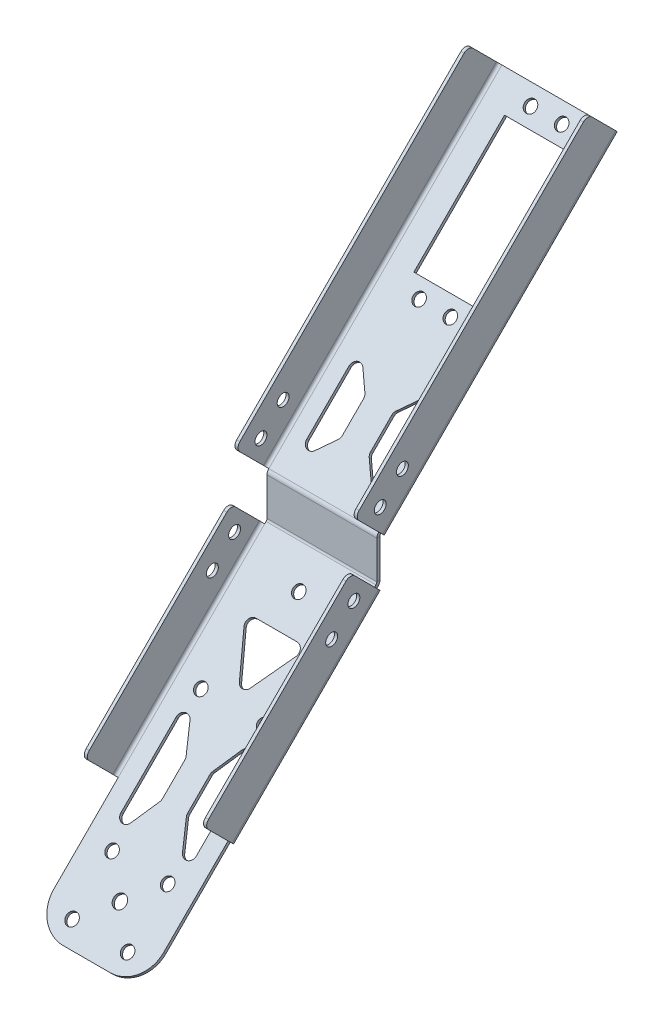
from build123d import *

# Parameters (mm, degrees)
BASE_FLANGE1_DEPTH     = 1
SKETCHED_START         = -32.5
SKETCHED_BEND5_DEPTH   = 65
SKETCHED_BEND5_2_DEPTH = 15
SKETCHED_START_2       = 17.5
SKETCHED_BEND5_3_DEPTH = 15
SKETCHED_BEND5_4_DEPTH = 65
SKETCHED_START_3       = -17.5
SKETCHED_BEND5_5_DEPTH = 35
SKETCHED_BEND6_DEPTH   = 65
SKETCHED_BEND6_2_DEPTH = 15
SKETCHED_BEND6_3_DEPTH = 15
SKETCHED_BEND6_4_DEPTH = 65
SKETCHED_BEND6_5_DEPTH = 35
SKETCHED_START_4       = -71.356310605
SKETCHED_BEND7_DEPTH   = 66
SKETCHED_BEND7_2_DEPTH = 66
SKETCHED_START_5       = 5.890889039
SKETCHED_BEND8_DEPTH   = 105
SKETCHED_BEND8_2_DEPTH = 105
F_6_CLEARANCE_HOLE2_D  = 3.7973
CUT_EXTRUDE1_REACH     = 121.977
SKETCH16_W             = 19.9
SKETCH16_H             = 40.84
CUT_EXTRUDE2_REACH     = 127.221
SKETCH31_R             = 2.025
F_6_CLEARANCE_HOLE4_D  = 3.7973
F_6_CLEARANCE_HOLE5_D  = 3.7973
FILLET1_R              = 10
FILLET2_R              = 2


# Read off the part's stored shape, not the designer's step: Sketched Bend5, Sketched Bend6, Sketched Bend7, Sketched Bend8
# Sheet-metal steps are written as plain solids
with BuildPart() as part:
    # Sketch1 → Base-Flange1 (new body)
    with BuildSketch(Plane.XY):
        Polygon((-32.5, -73.5), (-17.5, -73.5), (-17.5, -112.5), (17.5, -112.5), (17.5, -73.5), (32.5, -73.5), (32.5, -7.5), (17.5, -7.5), (17.5, 7.5), (32.5, 7.5), (32.5, 112.5), (17.5, 112.5), (-17.5, 112.5), (-32.5, 112.5), (-32.5, 7.5), (-17.5, 7.5), (-17.5, -7.5), (-32.5, -7.5), align=None)
    extrude(amount=-BASE_FLANGE1_DEPTH)

    # Sketched Bend5 outline → Sketched Bend5 (cut)
    with BuildSketch(Plane.YZ.offset(SKETCHED_START)):
        with BuildLine():
            Line((7.714213562, -0.585786438), (8.128427124, -1))
            Line((8.128427124, -1), (112.5, -1))
            Line((112.5, -1), (112.5, 0))
            Line((112.5, 0), (6.3, 0))
            ThreePointArc((6.3, 0), (7.065366865, -0.152240935), (7.714213562, -0.585786438))
        make_face()
    extrude(amount=SKETCHED_BEND5_DEPTH, mode=Mode.SUBTRACT)

    # Sketched Bend5 2 outline → Sketched Bend5 2 (cut)
    with BuildSketch(Plane.YZ.offset(SKETCHED_START)):
        with BuildLine():
            Line((7.729701149, -0.601274024), (7.714213562, -0.585786438))
            ThreePointArc((7.714213562, -0.585786438), (7.610403483, -0.48909209), (7.5, -0.4))
            Line((7.5, -0.4), (7.5, -0.830975173))
            Line((7.5, -0.830975173), (7.729701149, -0.601274024))
        make_face()
    extrude(amount=SKETCHED_BEND5_2_DEPTH, mode=Mode.SUBTRACT)

    # Sketched Bend5 3 outline → Sketched Bend5 3 (cut)
    with BuildSketch(Plane.YZ.offset(SKETCHED_START_2)):
        with BuildLine():
            Line((7.729701149, -0.601274024), (7.714213562, -0.585786438))
            ThreePointArc((7.714213562, -0.585786438), (7.610403483, -0.48909209), (7.5, -0.4))
            Line((7.5, -0.4), (7.5, -0.830975173))
            Line((7.5, -0.830975173), (7.729701149, -0.601274024))
        make_face()
    extrude(amount=SKETCHED_BEND5_3_DEPTH, mode=Mode.SUBTRACT)

    # Sketched Bend5 4 outline → Sketched Bend5 4 (add)
    with BuildSketch(Plane.YZ.offset(SKETCHED_START)):
        Polygon((81.975913173, -74.847486049), (8.128427124, -1), (7.5, -1), (7.5, -0.830975173), (7.022594368, -1.308380805), (81.268806392, -75.55459283), align=None)
    extrude(amount=SKETCHED_BEND5_4_DEPTH)

    # Sketched Bend5 5 outline → Sketched Bend5 5 (add)
    with BuildSketch(Plane.YZ.offset(SKETCHED_START_3)):
        with BuildLine():
            Line((7.022594368, -1.308380805), (7.330975173, -1))
            Line((7.330975173, -1), (6.3, -1))
            ThreePointArc((6.3, -1), (6.682683432, -1.076120467), (7.007106781, -1.292893219))
            Line((7.007106781, -1.292893219), (7.022594368, -1.308380805))
        make_face()
    extrude(amount=SKETCHED_BEND5_5_DEPTH)

    # Sketched Bend6 outline → Sketched Bend6 (cut)
    with BuildSketch(Plane.YZ.offset(SKETCHED_START)):
        with BuildLine():
            ThreePointArc((-5.710951377, -1), (-6.476318242, -0.847759065), (-7.12516494, -0.414213562))
            Line((-7.12516494, -0.414213562), (-7.539378502, 0))
            Line((-7.539378502, 0), (-112.5, 0))
            Line((-112.5, 0), (-112.5, -1))
            Line((-112.5, -1), (-5.710951377, -1))
        make_face()
    extrude(amount=SKETCHED_BEND6_DEPTH, mode=Mode.SUBTRACT)

    # Sketched Bend6 2 outline → Sketched Bend6 2 (cut)
    with BuildSketch(Plane.YZ.offset(SKETCHED_START)):
        Polygon((-7.539378502, 0), (-7.5, -0.039378502), (-7.5, 0), align=None)
    extrude(amount=SKETCHED_BEND6_2_DEPTH, mode=Mode.SUBTRACT)

    # Sketched Bend6 3 outline → Sketched Bend6 3 (cut)
    with BuildSketch(Plane.YZ.offset(SKETCHED_START_2)):
        Polygon((-7.539378502, 0), (-7.5, -0.039378502), (-7.5, 0), align=None)
    extrude(amount=SKETCHED_BEND6_3_DEPTH, mode=Mode.SUBTRACT)



with BuildPart() as body_2:
    # Sketched Bend6 4 outline → Sketched Bend6 4 (new body)
    with BuildSketch(Plane.YZ.offset(SKETCHED_START)):
        Polygon((-54.22622036, 46.686841858), (-7.557172802, 0.0177943), (-6.850066021, 0.724901081), (-53.519113579, 47.393948639), align=None)
    extrude(amount=SKETCHED_BEND6_4_DEPTH)


with BuildPart() as part_1:
    add(part.part)

    add(body_2.part)  # Sketched Bend6 5 merges body 2
    # Sketched Bend6 5 outline → Sketched Bend6 5 (add)
    with BuildSketch(Plane.YZ.offset(SKETCHED_START_3)):
        with BuildLine():
            Line((-7.557172802, 0.0177943), (-7.539378502, 0))
            Line((-7.539378502, 0), (-5.710951377, 0))
            ThreePointArc((-5.710951377, 0), (-6.09363481, 0.076120467), (-6.418058159, 0.292893219))
            Line((-6.418058159, 0.292893219), (-6.850066021, 0.724901081))
            Line((-6.850066021, 0.724901081), (-7.557172802, 0.0177943))
        make_face()
        Polygon((-81.803384826, 74.264006324), (-54.22622036, 46.686841858), (-53.519113579, 47.393948639), (-81.096278045, 74.971113105), align=None)
    extrude(amount=SKETCHED_BEND6_5_DEPTH)

    # Sketched Bend7 outline → Sketched Bend7 (cut)
    with BuildSketch(Plane(origin=(0, 0, 0), x_dir=(1, 0, 0), z_dir=(0, 0.707106781186546, -0.707106781186549)).offset(SKETCHED_START_4)):
        with BuildLine():
            ThreePointArc((-19.232050807, 4.331145665), (-18.5, 5.063196472), (-17.5, 5.331145665))
            Line((-17.5, 5.331145665), (-32.5, 5.331145665))
            Line((-32.5, 5.331145665), (-32.5, 4.331145665))
            Line((-32.5, 4.331145665), (-19.232050807, 4.331145665))
        make_face()
        with BuildLine():
            Line((32.5, 5.331145665), (17.5, 5.331145665))
            ThreePointArc((17.5, 5.331145665), (18.5, 5.063196472), (19.232050807, 4.331145665))
            Line((19.232050807, 4.331145665), (32.5, 4.331145665))
            Line((32.5, 4.331145665), (32.5, 5.331145665))
        make_face()
    extrude(amount=SKETCHED_BEND7_DEPTH, mode=Mode.SUBTRACT)

    # Sketched Bend7 2 outline → Sketched Bend7 2 (add)
    with BuildSketch(Plane(origin=(0, 0, 0), x_dir=(1, 0, 0), z_dir=(0, 0.707106781186546, -0.707106781186549)).offset(SKETCHED_START_4)):
        with BuildLine():
            Line((-17.5, 4.331145665), (-19.232050807, 4.331145665))
            ThreePointArc((-19.232050807, 4.331145665), (-19.431851652, 3.848783755), (-19.5, 3.331145665))
            Line((-19.5, 3.331145665), (-19.5, -9.312659845))
            Line((-19.5, -9.312659845), (-18.5, -9.312659845))
            Line((-18.5, -9.312659845), (-18.5, 3.331145665))
            ThreePointArc((-18.5, 3.331145665), (-18.207106781, 4.038252446), (-17.5, 4.331145665))
        make_face()
        with BuildLine():
            ThreePointArc((19.5, 3.331145665), (19.431851652, 3.848783755), (19.232050807, 4.331145665))
            Line((19.232050807, 4.331145665), (17.5, 4.331145665))
            ThreePointArc((17.5, 4.331145665), (18.207106781, 4.038252446), (18.5, 3.331145665))
            Line((18.5, 3.331145665), (18.5, -9.312659845))
            Line((18.5, -9.312659845), (19.5, -9.312659845))
            Line((19.5, -9.312659845), (19.5, 3.331145665))
        make_face()
    extrude(amount=SKETCHED_BEND7_2_DEPTH)

    # Sketched Bend8 outline → Sketched Bend8 (cut)
    with BuildSketch(Plane(origin=(0, 0, 0), x_dir=(1, 0, 0), z_dir=(0, 0.707106781186546, -0.707106781186549)).offset(SKETCHED_START_5)):
        with BuildLine():
            Line((-32.5, -5.040559159), (-19.232050807, -5.040559159))
            ThreePointArc((-19.232050807, -5.040559159), (-18.5, -4.308508352), (-17.5, -4.040559159))
            Line((-17.5, -4.040559159), (-32.5, -4.040559159))
            Line((-32.5, -4.040559159), (-32.5, -5.040559159))
        make_face()
        with BuildLine():
            Line((32.5, -4.040559159), (17.5, -4.040559159))
            ThreePointArc((17.5, -4.040559159), (18.5, -4.308508352), (19.232050807, -5.040559159))
            Line((19.232050807, -5.040559159), (32.5, -5.040559159))
            Line((32.5, -5.040559159), (32.5, -4.040559159))
        make_face()
    extrude(amount=SKETCHED_BEND8_DEPTH, mode=Mode.SUBTRACT)

    # Sketched Bend8 2 outline → Sketched Bend8 2 (add)
    with BuildSketch(Plane(origin=(0, 0, 0), x_dir=(1, 0, 0), z_dir=(0, 0.707106781186546, -0.707106781186549)).offset(SKETCHED_START_5)):
        with BuildLine():
            ThreePointArc((-19.232050807, -5.040559159), (-19.431851652, -5.522921069), (-19.5, -6.040559159))
            Line((-19.5, -6.040559159), (-19.5, -18.684364669))
            Line((-19.5, -18.684364669), (-18.5, -18.684364669))
            Line((-18.5, -18.684364669), (-18.5, -6.040559159))
            ThreePointArc((-18.5, -6.040559159), (-18.207106781, -5.333452378), (-17.5, -5.040559159))
            Line((-17.5, -5.040559159), (-19.232050807, -5.040559159))
        make_face()
        with BuildLine():
            Line((19.232050807, -5.040559159), (17.5, -5.040559159))
            ThreePointArc((17.5, -5.040559159), (18.207106781, -5.333452378), (18.5, -6.040559159))
            Line((18.5, -6.040559159), (18.5, -18.684364669))
            Line((18.5, -18.684364669), (19.5, -18.684364669))
            Line((19.5, -18.684364669), (19.5, -6.040559159))
            ThreePointArc((19.5, -6.040559159), (19.431851652, -5.522921069), (19.232050807, -5.040559159))
        make_face()
    extrude(amount=SKETCHED_BEND8_2_DEPTH)

    # #6 Clearance Hole2 (through all)
    with Locations(Plane(origin=(19.5, 0, 0), x_dir=(0, 0, -1), z_dir=(1, 0, 0))):
        with Locations((-9.311868306, -5.334166607), (-16.382936118, -12.405234419), (-0.914625389, 16.316668374), (6.156442422, 23.387736186)):
            Hole(F_6_CLEARANCE_HOLE2_D / 2)

    # Sketch16 → Cut-Extrude1 (cut, up to next)
    with BuildSketch(Plane(origin=(0, 3.564213562, 3.564213562), x_dir=(1, 0, 0), z_dir=(0, 0.7071067811865487, 0.7071067811865465)), mode=Mode.PRIVATE) as cut_extrude1_sk1:
        with BuildLine():
            Line((-12.5, 34.910953453), (-12.5, 15.870824627))
            ThreePointArc((-12.5, 15.870824627), (-11.185694979, 13.992042469), (-8.970177604, 14.582553136))
            Line((-8.970177604, 14.582553136), (-4.970177604, 19.332553136))
            ThreePointArc((-4.970177604, 19.332553136), (-4.621217842, 19.935129648), (-4.5, 20.620824627))
            Line((-4.5, 20.620824627), (-4.5, 30.160953453))
            ThreePointArc((-4.5, 30.160953453), (-4.621217842, 30.846648432), (-4.970177604, 31.449224944))
            Line((-4.970177604, 31.449224944), (-8.970177604, 36.199224944))
            ThreePointArc((-8.970177604, 36.199224944), (-11.185694979, 36.789735611), (-12.5, 34.910953453))
        make_face()
    cut_extrude1_tool1 = extrude(cut_extrude1_sk1.sketch, amount=-CUT_EXTRUDE1_REACH, mode=Mode.PRIVATE) & part_1.part
    # Sketch16 → Cut-Extrude1 (cut, up to next)
    with BuildSketch(Plane(origin=(0, 3.564213562, 3.564213562), x_dir=(1, 0, 0), z_dir=(0, 0.7071067811865487, 0.7071067811865465)), mode=Mode.PRIVATE) as cut_extrude1_sk2:
        with BuildLine():
            Line((4.5, 20.620824627), (4.5, 30.160953453))
            ThreePointArc((4.5, 30.160953453), (4.621217842, 30.846648432), (4.970177604, 31.449224944))
            Line((4.970177604, 31.449224944), (8.970177604, 36.199224944))
            ThreePointArc((8.970177604, 36.199224944), (11.185694979, 36.789735611), (12.5, 34.910953453))
            Line((12.5, 34.910953453), (12.5, 15.870824627))
            ThreePointArc((12.5, 15.870824627), (11.185694979, 13.992042469), (8.970177604, 14.582553136))
            Line((8.970177604, 14.582553136), (4.970177604, 19.332553136))
            ThreePointArc((4.970177604, 19.332553136), (4.621217842, 19.935129648), (4.5, 20.620824627))
        make_face()
    cut_extrude1_tool2 = extrude(cut_extrude1_sk2.sketch, amount=-CUT_EXTRUDE1_REACH, mode=Mode.PRIVATE) & part_1.part
    # Sketch16 → Cut-Extrude1 (cut, up to next)
    with BuildSketch(Plane(origin=(0, 3.564213562, 3.564213562), x_dir=(1, 0, 0), z_dir=(0, 0.7071067811865487, 0.7071067811865465)), mode=Mode.PRIVATE) as cut_extrude1_sk3:
        with Locations((0, 80.970889039)):
            Rectangle(SKETCH16_W, SKETCH16_H)
    cut_extrude1_tool3 = extrude(cut_extrude1_sk3.sketch, amount=-CUT_EXTRUDE1_REACH, mode=Mode.PRIVATE) & part_1.part
    add(cut_extrude1_tool1.solids().sort_by_distance((-8.925772, 21.518283, -14.389856))[0], mode=Mode.SUBTRACT)
    add(cut_extrude1_tool2.solids().sort_by_distance((8.925772, 21.518283, -14.389856))[0], mode=Mode.SUBTRACT)
    add(cut_extrude1_tool3.solids().sort_by_distance((0, 60.819278, -53.690851))[0], mode=Mode.SUBTRACT)

    # Sketch31 → Cut-Extrude2 (cut, up to next)
    with BuildSketch(Plane(origin=(0, -3.769689251, -3.769689251), x_dir=(-1, 0, 0), z_dir=(0, -0.7071067811865487, -0.7071067811865465)), mode=Mode.PRIVATE) as cut_extrude2_sk1:
        with Locations(Location((0, -95.356310605, 0), (0, 0, 90))):
            Circle(SKETCH31_R)
    cut_extrude2_tool1 = extrude(cut_extrude2_sk1.sketch, amount=-CUT_EXTRUDE2_REACH, mode=Mode.PRIVATE) & part_1.part
    # Sketch31 → Cut-Extrude2 (cut, up to next)
    with BuildSketch(Plane(origin=(0, -3.769689251, -3.769689251), x_dir=(-1, 0, 0), z_dir=(0, -0.7071067811865487, -0.7071067811865465)), mode=Mode.PRIVATE) as cut_extrude2_sk2:
        with BuildLine():
            Line((1.732050808, -39.065867303), (8.267949192, -27.745359227))
            ThreePointArc((8.267949192, -27.745359227), (8.267949192, -25.745359227), (6.535898385, -24.745359227))
            Line((6.535898385, -24.745359227), (-6.535898385, -24.745359227))
            ThreePointArc((-6.535898385, -24.745359227), (-8.267949192, -25.745359227), (-8.267949192, -27.745359227))
            Line((-8.267949192, -27.745359227), (-1.732050808, -39.065867303))
            ThreePointArc((-1.732050808, -39.065867303), (0, -40.065867303), (1.732050808, -39.065867303))
        make_face()
    cut_extrude2_tool2 = extrude(cut_extrude2_sk2.sketch, amount=-CUT_EXTRUDE2_REACH, mode=Mode.PRIVATE) & part_1.part
    # Sketch31 → Cut-Extrude2 (cut, up to next)
    with BuildSketch(Plane(origin=(0, -3.769689251, -3.769689251), x_dir=(-1, 0, 0), z_dir=(0, -0.7071067811865487, -0.7071067811865465)), mode=Mode.PRIVATE) as cut_extrude2_sk3:
        with BuildLine():
            Line((-12, -53.065867303), (-12, -77.856310605))
            ThreePointArc((-12, -77.856310605), (-10.490758652, -79.795164891), (-8.240844055, -78.807820122))
            Line((-8.240844055, -78.807820122), (-4.240844055, -71.412598471))
            ThreePointArc((-4.240844055, -71.412598471), (-4.061145713, -70.951847606), (-4, -70.461088954))
            Line((-4, -70.461088954), (-4, -60.461088954))
            ThreePointArc((-4, -60.461088954), (-4.061145713, -59.970330301), (-4.240844055, -59.509579437))
            Line((-4.240844055, -59.509579437), (-8.240844055, -52.114357786))
            ThreePointArc((-8.240844055, -52.114357786), (-10.490758652, -51.127013016), (-12, -53.065867303))
        make_face()
    cut_extrude2_tool3 = extrude(cut_extrude2_sk3.sketch, amount=-CUT_EXTRUDE2_REACH, mode=Mode.PRIVATE) & part_1.part
    # Sketch31 → Cut-Extrude2 (cut, up to next)
    with BuildSketch(Plane(origin=(0, -3.769689251, -3.769689251), x_dir=(-1, 0, 0), z_dir=(0, -0.7071067811865487, -0.7071067811865465)), mode=Mode.PRIVATE) as cut_extrude2_sk4:
        with BuildLine():
            Line((4, -70.461088954), (4, -60.461088954))
            ThreePointArc((4, -60.461088954), (4.061145713, -59.970330301), (4.240844055, -59.509579437))
            Line((4.240844055, -59.509579437), (8.240844055, -52.114357786))
            ThreePointArc((8.240844055, -52.114357786), (10.490758652, -51.127013016), (12, -53.065867303))
            Line((12, -53.065867303), (12, -77.856310605))
            ThreePointArc((12, -77.856310605), (10.490758652, -79.795164891), (8.240844055, -78.807820122))
            Line((8.240844055, -78.807820122), (4.240844055, -71.412598471))
            ThreePointArc((4.240844055, -71.412598471), (4.061145713, -70.951847606), (4, -70.461088954))
        make_face()
    cut_extrude2_tool4 = extrude(cut_extrude2_sk4.sketch, amount=-CUT_EXTRUDE2_REACH, mode=Mode.PRIVATE) & part_1.part
    add(cut_extrude2_tool1.solids().sort_by_distance((0, -71.196783, 63.657405))[0], mode=Mode.SUBTRACT)
    add(cut_extrude2_tool2.solids().sort_by_distance((0, -25.349783, 17.810405))[0], mode=Mode.SUBTRACT)
    add(cut_extrude2_tool3.solids().sort_by_distance((8.518356, -50.057669, 42.518291))[0], mode=Mode.SUBTRACT)
    add(cut_extrude2_tool4.solids().sort_by_distance((-8.518356, -50.057669, 42.518291))[0], mode=Mode.SUBTRACT)

    # #6 Clearance Hole4 (through all)
    with Locations(Plane(origin=(0, -3.769689251, -3.769689251), x_dir=(-1, 0, 0), z_dir=(0, -0.7071067811865487, -0.7071067811865465))):
        with Locations((-10, -44.745359227), (10, -44.745359227), (0, -14.745359227), (-8.990903672, -86.531157138), (8.825153467, -86.365406932), (8.990903672, -104.181464072), (-8.825153467, -104.347214277)):
            Hole(F_6_CLEARANCE_HOLE4_D / 2)

    # #6 Clearance Hole5 (through all)
    with Locations(Plane(origin=(0, 2.857106781, 2.857106781), x_dir=(-1, 0, 0), z_dir=(0, -0.7071067811865487, -0.7071067811865465))):
        with Locations((4.97, 106.070889039), (-4.97, 106.070889039), (4.97, 55.870889039), (-4.97, 55.870889039)):
            Hole(F_6_CLEARANCE_HOLE5_D / 2)

    # Fillet1
    fillet1_edges = [part_1.edges().sort_by_distance(p)[0] for p in [
        (-17.5, -81.449831436, 74.617559715),
        (17.5, -81.449831436, 74.617559715),
    ]]
    fillet(fillet1_edges, radius=FILLET1_R)

    # Fillet2
    fillet2_edges = [part_1.edges().sort_by_distance(p)[0] for p in [
        (-19, -43.871486182, 57.041576037),
        (-19, 2.797561376, 10.372528478),
        (19, 2.797561376, 10.372528478),
        (19, -43.871486182, 57.041576037),
        (-19, 17.377328546, 9.046353373),
        (-19, 91.623540571, -65.199858652),
        (19, 91.623540571, -65.199858652),
        (19, 17.377328546, 9.046353373),
    ]]
    fillet(fillet2_edges, radius=FILLET2_R)


solid = part_1.part
